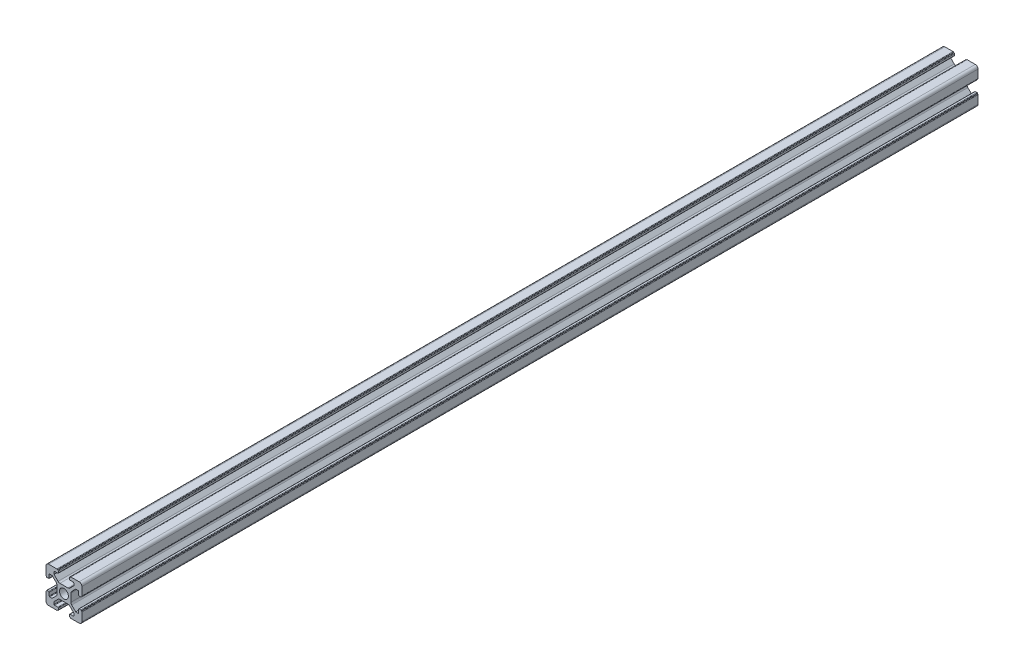
from build123d import *

# Parameters (mm, degrees)
BOSS_EXTRUDE1_DEPTH = 500
F_3DSKETCH2_R       = 2.5
CUT_EXTRUDE1_DEPTH  = 501.200028064


with BuildPart() as part:
    # Sketch1 → Boss-Extrude1 (new body)
    with BuildSketch(Plane.XY):
        with BuildLine():
            ThreePointArc((-4.339541497, 3.27832502), (-4.01438237, 2.791689997), (-3.900201668, 2.217664848))
            Line((-3.900201668, 2.217664848), (-3.900201668, -2.220777458))
            ThreePointArc((-3.900201668, -2.220777458), (-4.013982246, -2.793835668), (-4.338062619, -3.279956687))
            ThreePointArc((-4.338062619, -3.279956687), (-4.338801799, -3.280697416), (-4.339541497, -3.28143763))
            Line((-4.339541497, -3.28143763), (-6.559305445, -5.501201578))
            Line((-6.559305445, -5.501201578), (-7.918645273, -5.501201578))
            ThreePointArc((-7.918645273, -5.501201578), (-8.116635172, -5.419191476), (-8.198645273, -5.221201578))
            Line((-8.198645273, -5.221201578), (-8.198645273, -3.381201578))
            ThreePointArc((-8.198645273, -3.381201578), (-8.280655374, -3.183211679), (-8.478645273, -3.101201578))
            Line((-8.478645273, -3.101201578), (-9.418645273, -3.101201578))
            ThreePointArc((-9.418645273, -3.101201578), (-9.616635172, -3.183211679), (-9.698645273, -3.381201578))
            Line((-9.698645273, -3.381201578), (-9.698645273, -3.601201578))
            Line((-9.698645273, -3.601201578), (-9.718645273, -3.601201578))
            ThreePointArc((-9.718645273, -3.601201578), (-9.916635172, -3.683211679), (-9.998645273, -3.881201578))
            Line((-9.998645273, -3.881201578), (-9.998645273, -8.501201578))
            ThreePointArc((-9.998645273, -8.501201578), (-9.559305445, -9.561861749), (-8.498645273, -10.001201578))
            Line((-8.498645273, -10.001201578), (-3.878645273, -10.001201578))
            ThreePointArc((-3.878645273, -10.001201578), (-3.680655374, -9.919191476), (-3.598645273, -9.721201578))
            Line((-3.598645273, -9.721201578), (-3.598645273, -9.701201578))
            Line((-3.598645273, -9.701201578), (-3.378645273, -9.701201578))
            ThreePointArc((-3.378645273, -9.701201578), (-3.180655374, -9.619191476), (-3.098645273, -9.421201578))
            Line((-3.098645273, -9.421201578), (-3.098645273, -8.481201578))
            ThreePointArc((-3.098645273, -8.481201578), (-3.180655374, -8.283211679), (-3.378645273, -8.201201578))
            Line((-3.378645273, -8.201201578), (-5.218645273, -8.201201578))
            ThreePointArc((-5.218645273, -8.201201578), (-5.416635172, -8.119191476), (-5.498645273, -7.921201578))
            Line((-5.498645273, -7.921201578), (-5.498645273, -6.561861749))
            Line((-5.498645273, -6.561861749), (-3.277324929, -4.340541406))
            ThreePointArc((-3.277324929, -4.340541406), (-2.790689906, -4.015382279), (-2.216664757, -3.901201578))
            Line((-2.216664757, -3.901201578), (2.234977304, -3.899793498))
            ThreePointArc((2.234977304, -3.899793498), (2.801097117, -4.016727825), (3.280957809, -4.339061494))
            Line((3.280957809, -4.339061494), (5.502201668, -6.560305354))
            Line((5.502201668, -6.560305354), (5.502201668, -7.919645182))
            ThreePointArc((5.502201668, -7.919645182), (5.420191567, -8.117635081), (5.222201668, -8.199645182))
            Line((5.222201668, -8.199645182), (3.382201668, -8.199645182))
            ThreePointArc((3.382201668, -8.199645182), (3.18421177, -8.281655283), (3.102201668, -8.479645182))
            Line((3.102201668, -8.479645182), (3.102201668, -9.419645182))
            ThreePointArc((3.102201668, -9.419645182), (3.18421177, -9.617635081), (3.382201668, -9.699645182))
            Line((3.382201668, -9.699645182), (3.602201668, -9.699645182))
            Line((3.602201668, -9.699645182), (3.602201668, -9.719645182))
            ThreePointArc((3.602201668, -9.719645182), (3.68421177, -9.917635081), (3.882201668, -9.999645182))
            Line((3.882201668, -9.999645182), (8.502201668, -9.999645182))
            ThreePointArc((8.502201668, -9.999645182), (9.56286184, -9.560305354), (10.002201668, -8.499645182))
            Line((10.002201668, -8.499645182), (10.002201668, -3.879645182))
            ThreePointArc((10.002201668, -3.879645182), (9.920191567, -3.681655283), (9.722201668, -3.599645182))
            Line((9.722201668, -3.599645182), (9.702201668, -3.599645182))
            Line((9.702201668, -3.599645182), (9.702201668, -3.379645182))
            ThreePointArc((9.702201668, -3.379645182), (9.620191567, -3.181655283), (9.422201668, -3.099645182))
            Line((9.422201668, -3.099645182), (8.482201668, -3.099645182))
            ThreePointArc((8.482201668, -3.099645182), (8.28421177, -3.181655283), (8.202201668, -3.379645182))
            Line((8.202201668, -3.379645182), (8.202201668, -5.219645182))
            ThreePointArc((8.202201668, -5.219645182), (8.120191567, -5.417635081), (7.922201668, -5.499645182))
            Line((7.922201668, -5.499645182), (6.56286184, -5.499645182))
            Line((6.56286184, -5.499645182), (4.341541497, -3.278324838))
            ThreePointArc((4.341541497, -3.278324838), (4.01638237, -2.791689815), (3.902201668, -2.217664667))
            Line((3.902201668, -2.217664667), (3.900793589, 2.233977395))
            ThreePointArc((3.900793589, 2.233977395), (4.017727916, 2.800097207), (4.340061585, 3.2799579))
            Line((4.340061585, 3.2799579), (6.561305445, 5.501201759))
            Line((6.561305445, 5.501201759), (7.920645273, 5.501201759))
            ThreePointArc((7.920645273, 5.501201759), (8.118635172, 5.419191658), (8.200645273, 5.221201759))
            Line((8.200645273, 5.221201759), (8.200645273, 3.381201759))
            ThreePointArc((8.200645273, 3.381201759), (8.282655374, 3.183211861), (8.480645273, 3.101201759))
            Line((8.480645273, 3.101201759), (9.420645273, 3.101201759))
            ThreePointArc((9.420645273, 3.101201759), (9.618635172, 3.183211861), (9.700645273, 3.381201759))
            Line((9.700645273, 3.381201759), (9.700645273, 3.601201759))
            Line((9.700645273, 3.601201759), (9.720645273, 3.601201759))
            ThreePointArc((9.720645273, 3.601201759), (9.918635172, 3.683211861), (10.000645273, 3.881201759))
            Line((10.000645273, 3.881201759), (10.000645273, 8.501201759))
            ThreePointArc((10.000645273, 8.501201759), (9.561305445, 9.561861931), (8.500645273, 10.001201759))
            Line((8.500645273, 10.001201759), (3.880645273, 10.001201759))
            ThreePointArc((3.880645273, 10.001201759), (3.682655374, 9.919191658), (3.600645273, 9.721201759))
            Line((3.600645273, 9.721201759), (3.600645273, 9.701201759))
            Line((3.600645273, 9.701201759), (3.380645273, 9.701201759))
            ThreePointArc((3.380645273, 9.701201759), (3.182655374, 9.619191658), (3.100645273, 9.421201759))
            Line((3.100645273, 9.421201759), (3.100645273, 8.481201759))
            ThreePointArc((3.100645273, 8.481201759), (3.182655374, 8.283211861), (3.380645273, 8.201201759))
            Line((3.380645273, 8.201201759), (5.220645273, 8.201201759))
            ThreePointArc((5.220645273, 8.201201759), (5.418635172, 8.119191658), (5.500645273, 7.921201759))
            Line((5.500645273, 7.921201759), (5.500645273, 6.561861931))
            Line((5.500645273, 6.561861931), (3.279324929, 4.340541588))
            ThreePointArc((3.279324929, 4.340541588), (2.792689906, 4.015382461), (2.218664757, 3.901201759))
            Line((2.218664757, 3.901201759), (-2.232977304, 3.89979368))
            ThreePointArc((-2.232977304, 3.89979368), (-2.799097117, 4.016728006), (-3.278957809, 4.339061676))
            Line((-3.278957809, 4.339061676), (-5.500201668, 6.560305535))
            Line((-5.500201668, 6.560305535), (-5.500201668, 7.919645364))
            ThreePointArc((-5.500201668, 7.919645364), (-5.418191567, 8.117635262), (-5.220201668, 8.199645364))
            Line((-5.220201668, 8.199645364), (-3.380201668, 8.199645364))
            ThreePointArc((-3.380201668, 8.199645364), (-3.18221177, 8.281655465), (-3.100201668, 8.479645364))
            Line((-3.100201668, 8.479645364), (-3.100201668, 9.419645364))
            ThreePointArc((-3.100201668, 9.419645364), (-3.18221177, 9.617635262), (-3.380201668, 9.699645364))
            Line((-3.380201668, 9.699645364), (-3.600201668, 9.699645364))
            Line((-3.600201668, 9.699645364), (-3.600201668, 9.719645364))
            ThreePointArc((-3.600201668, 9.719645364), (-3.68221177, 9.917635262), (-3.880201668, 9.999645364))
            Line((-3.880201668, 9.999645364), (-8.500201668, 9.999645364))
            ThreePointArc((-8.500201668, 9.999645364), (-9.56086184, 9.560305535), (-10.000201668, 8.499645364))
            Line((-10.000201668, 8.499645364), (-10.000201668, 3.879645364))
            ThreePointArc((-10.000201668, 3.879645364), (-9.918191567, 3.681655465), (-9.720201668, 3.599645364))
            Line((-9.720201668, 3.599645364), (-9.700201668, 3.599645364))
            Line((-9.700201668, 3.599645364), (-9.700201668, 3.379645364))
            ThreePointArc((-9.700201668, 3.379645364), (-9.618191567, 3.181655465), (-9.420201668, 3.099645364))
            Line((-9.420201668, 3.099645364), (-8.480201668, 3.099645364))
            ThreePointArc((-8.480201668, 3.099645364), (-8.28221177, 3.181655465), (-8.200201668, 3.379645364))
            Line((-8.200201668, 3.379645364), (-8.200201668, 5.219645364))
            ThreePointArc((-8.200201668, 5.219645364), (-8.118191567, 5.417635262), (-7.920201668, 5.499645364))
            Line((-7.920201668, 5.499645364), (-6.56086184, 5.499645364))
            Line((-6.56086184, 5.499645364), (-4.339541497, 3.27832502))
        make_face()
    extrude(amount=BOSS_EXTRUDE1_DEPTH)

    # 3DSketch2 → Cut-Extrude1 (cut, through all)
    with BuildSketch(Plane.XY):
        Circle(F_3DSKETCH2_R)
    extrude(amount=CUT_EXTRUDE1_DEPTH, mode=Mode.SUBTRACT)


solid = part.part
